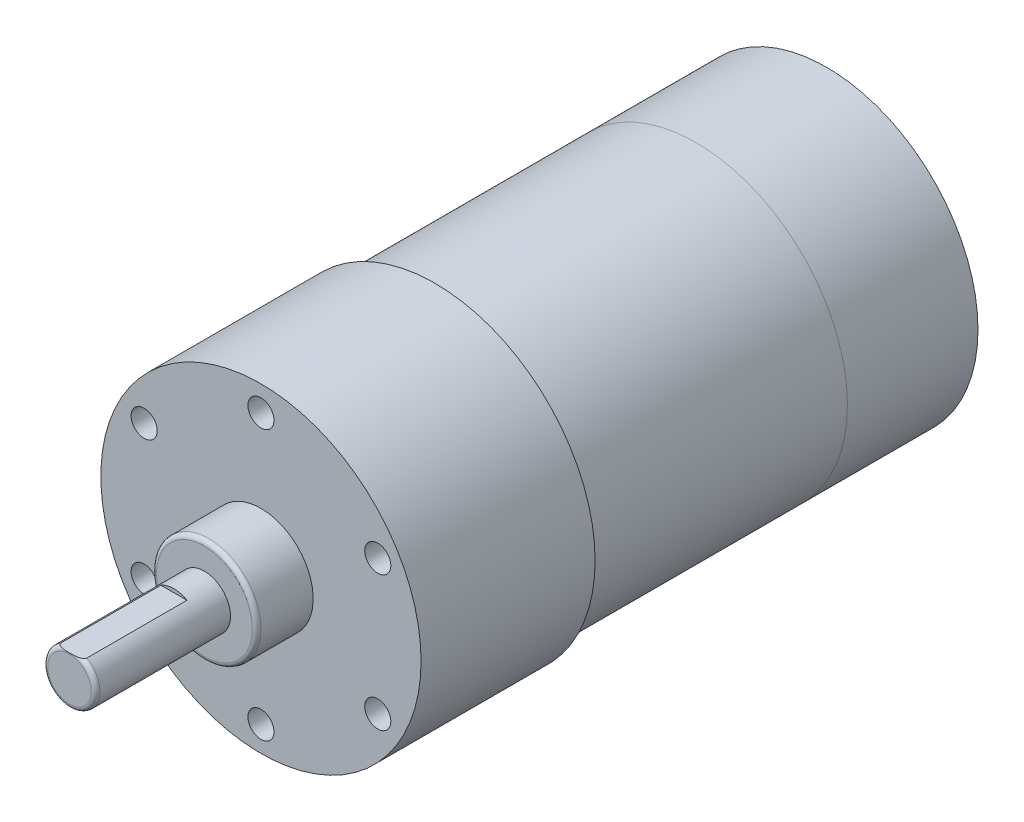
from build123d import *

# Parameters (mm, degrees)
SKETCH1_R                    = 18.4
BOSS_EXTRUDE1_DEPTH          = 20
SKETCH2_R                    = 17.4
BOSS_EXTRUDE2_DEPTH          = 30
SKETCH3_R                    = 6
BOSS_EXTRUDE3_DEPTH          = 6.5
FILLET1_R                    = 0.5
SKETCH4_R                    = 3
BOSS_EXTRUDE4_DEPTH          = 15.5
CUT_EXTRUDE1_START           = -12
CUT_EXTRUDE1_DEPTH           = 12
F_3_0_3_DIAMETER_HOLE1_D     = 3
F_3_0_3_DIAMETER_HOLE1_DEPTH = 3
F_3_0_3_DIAMETER_HOLE1_TIP   = 0.901290929
FILLET4_R                    = 0.5
CROQUIS1_R                   = 17.4
SALIENTE_EXTRUIR3_DEPTH      = 15


with BuildPart() as part:
    # Sketch1 → Boss-Extrude1 (new body)
    with BuildSketch(Plane.XY):
        Circle(SKETCH1_R)
    extrude(amount=BOSS_EXTRUDE1_DEPTH)

    # Sketch2 → Boss-Extrude2 (add)
    with BuildSketch(Plane(origin=(0, 0, 0), x_dir=(-1, 0, 0), z_dir=(0, 0, -1))):
        with Locations(Location((0, 0, 0), (0, 0, 180))):
            Circle(SKETCH2_R)
    extrude(amount=BOSS_EXTRUDE2_DEPTH)

    # Sketch3 → Boss-Extrude3 (add)
    with BuildSketch(Plane.XY.offset(20)):
        with Locations(Location((0, 0, 0), (0, 0, 180))):
            Circle(SKETCH3_R)
    extrude(amount=BOSS_EXTRUDE3_DEPTH)

    # Fillet1
    fillet1_edges = [part.edges().sort_by_distance(p)[0] for p in [
        (6, 0, 26.5),
    ]]
    fillet(fillet1_edges, radius=FILLET1_R)

    # Sketch4 → Boss-Extrude4 (add)
    with BuildSketch(Plane.XY.offset(26.5)):
        Circle(SKETCH4_R)
    extrude(amount=BOSS_EXTRUDE4_DEPTH)

    # Sketch5 → Cut-Extrude1 (cut)
    with BuildSketch(Plane.XY.offset(42).offset(CUT_EXTRUDE1_START)):
        with BuildLine():
            Line((-1.496662955, 2.6), (1.496662955, 2.6))
            ThreePointArc((1.496662955, 2.6), (0, 3), (-1.496662955, 2.6))
        make_face()
    extrude(amount=CUT_EXTRUDE1_DEPTH, mode=Mode.SUBTRACT)

    # Ø3.0 (3) Diameter Hole1
    with Locations(Plane.XY.offset(20)):
        with Locations((-13.423393759, 7.75), (-13.423393759, -7.75), (0, -15.5), (13.423393759, 7.75), (0, 15.5), (13.423393759, -7.75)):
            Hole(F_3_0_3_DIAMETER_HOLE1_D / 2, depth=F_3_0_3_DIAMETER_HOLE1_DEPTH)
            with Locations((0, 0, -(F_3_0_3_DIAMETER_HOLE1_DEPTH + F_3_0_3_DIAMETER_HOLE1_TIP / 2))):  # 118° drill point
                Cone(0, F_3_0_3_DIAMETER_HOLE1_D / 2, F_3_0_3_DIAMETER_HOLE1_TIP, mode=Mode.SUBTRACT)

    # Fillet4
    # the kernel refuses this fillet: 0.5 mm, written as the material it takes off along each edge
    with BuildSketch(Plane(origin=(0, 0, 42), x_dir=(0.46226557285945985, 0.8867415295050273, 0), z_dir=(0.8867415295050273, -0.46226557285945985, 0))) as fillet4_piece_1:
        with BuildLine():
            CenterArc((3 - FILLET4_R, -FILLET4_R), FILLET4_R, 0, 90)
            Line((3 - FILLET4_R, 0), (3 - FILLET4_R, FILLET4_R * 0.02))
            Line((3 - FILLET4_R, FILLET4_R * 0.02), (3 + FILLET4_R * 0.02, FILLET4_R * 0.02))
            Line((3 + FILLET4_R * 0.02, FILLET4_R * 0.02), (3 + FILLET4_R * 0.02, -FILLET4_R))
            Line((3 + FILLET4_R * 0.02, -FILLET4_R), (3, -FILLET4_R))
        make_face()
    revolve(axis=Axis((0, 0, 42), (0, 0, 1)), revolution_arc=297.533397677, mode=Mode.SUBTRACT)
    with BuildSketch(Plane(origin=(0, 0, 42), x_dir=(1, 0, 0), z_dir=(0, -1, 0))) as fillet4_piece_2:
        with BuildLine():
            CenterArc((3 - FILLET4_R, -FILLET4_R), FILLET4_R, 0, 90)
            Line((3 - FILLET4_R, 0), (3 - FILLET4_R, FILLET4_R * 0.02))
            Line((3 - FILLET4_R, FILLET4_R * 0.02), (3 + FILLET4_R * 0.02, FILLET4_R * 0.02))
            Line((3 + FILLET4_R * 0.02, FILLET4_R * 0.02), (3 + FILLET4_R * 0.02, -FILLET4_R))
            Line((3 + FILLET4_R * 0.02, -FILLET4_R), (3, -FILLET4_R))
        make_face()
    revolve(axis=Axis((0, 0, 42), (0, 0, 1)), revolution_arc=117.379597562, mode=Mode.SUBTRACT)


with BuildPart() as body_2:
    # Croquis1 → Saliente-Extruir3 (new body)
    with BuildSketch(Plane(origin=(0, 0, -30), x_dir=(-1, 0, 0), z_dir=(0, 0, -1))):
        Circle(CROQUIS1_R)
    extrude(amount=SALIENTE_EXTRUIR3_DEPTH)


solid = Compound([part.part, body_2.part])
